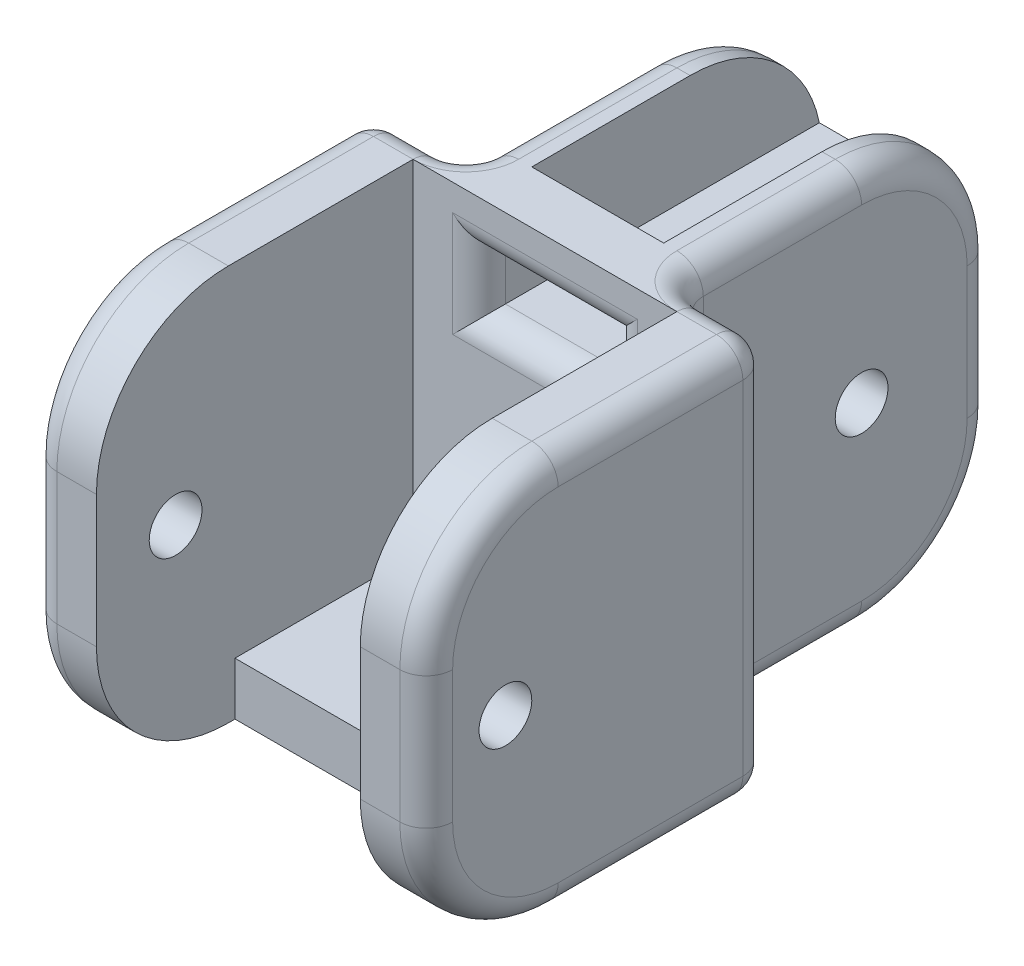
from build123d import *

# Parameters (mm, degrees)
BASE_SKETCH_W                    = 15
BASE_SKETCH_H                    = 15
BASE_SKETCH_EXTRUDE_DEPTH        = 25
CENTER_NUB_CUTOUT_SKETCH_W       = 3.5
CENTER_NUB_CUTOUT_SKETCH_H       = 15
HINGE_NUB_EXTRUDED_CUT_DEPTH     = 12
HINGE_CUTOUT_SKETCH_W            = 10
HINGE_CUTOUT_SKETCH_H            = 15
HINGE_CUTOUT_EXTRUDED_CUT_DEPTH  = 12
HINGE_HOLE_SKETCH_R              = 1
HINGE_HOLE_EXTRUDED_CUT_DEPTH    = 31.103986447
CORNER_FILLETS_R                 = 5
STYLE_FILLETS_R                  = 1
ROUTING_HOLES_SKETCH_W           = 5
ROUTING_HOLES_SKETCH_H           = 2
ROUTING_HOLES_EXTRUDED_CUT_DEPTH = 28.156951228
SKETCH1_W                        = 10
SKETCH1_H                        = 2
BACKING_EXTRUDE_DEPTH            = 6.75
EXTRA_ROUTING_CUT_SKETCH_W       = 5
EXTRA_ROUTING_CUT_SKETCH_H       = 10
EXTRA_ROUTING_EXTRUDED_CUT_DEPTH = 4
ROUTING_FILLETS_R                = 1


with BuildPart() as part:
    # Base Sketch → Base Sketch Extrude (new body)
    with BuildSketch(Plane.XY):
        Rectangle(BASE_SKETCH_W, BASE_SKETCH_H)
    extrude(amount=BASE_SKETCH_EXTRUDE_DEPTH)

    # Center Nub Cutout Sketch → Hinge Nub Extruded Cut (cut)
    with BuildSketch(Plane.XY):
        with Locations((5.75, 0)):
            Rectangle(CENTER_NUB_CUTOUT_SKETCH_W, CENTER_NUB_CUTOUT_SKETCH_H)
        with Locations((-5.75, 0)):
            Rectangle(CENTER_NUB_CUTOUT_SKETCH_W, CENTER_NUB_CUTOUT_SKETCH_H)
    extrude(amount=HINGE_NUB_EXTRUDED_CUT_DEPTH, mode=Mode.SUBTRACT)

    # Hinge Cutout Sketch → Hinge Cutout Extruded Cut (cut)
    with BuildSketch(Plane.XY.offset(25)):
        Rectangle(HINGE_CUTOUT_SKETCH_W, HINGE_CUTOUT_SKETCH_H)
    extrude(amount=-HINGE_CUTOUT_EXTRUDED_CUT_DEPTH, mode=Mode.SUBTRACT)

    # Hinge Hole Sketch → Hinge Hole Extruded Cut (cut, through all)
    with BuildSketch(Plane(origin=(7.5, 0, 0), x_dir=(0, 0, -1), z_dir=(1, 0, 0))):
        with Locations(Location((-5, 0, 0), (0, 0, 90))):
            Circle(HINGE_HOLE_SKETCH_R)
        with Locations(Location((-22, 0, 0), (0, 0, 90))):
            Circle(HINGE_HOLE_SKETCH_R)
    extrude(amount=-HINGE_HOLE_EXTRUDED_CUT_DEPTH, mode=Mode.SUBTRACT)

    # Corner Fillets
    corner_fillets_edges = [part.edges().sort_by_distance(p)[0] for p in [
        (0, -7.5, 0),
        (0, 7.5, 0),
        (-6.25, -7.5, 25),
        (-6.25, 7.5, 25),
        (6.25, -7.5, 25),
        (6.25, 7.5, 25),
    ]]
    fillet(corner_fillets_edges, radius=CORNER_FILLETS_R)

    # Style Fillets
    style_fillets_edges = [part.edges().sort_by_distance(p)[0] for p in [
        (4, 7.5, 8.5),
        (4, -7.5, 8.5),
        (7.5, 0, 12),
        (5.75, 7.5, 12),
        (4, 0, 12),
        (5.75, -7.5, 12),
        (-4, -7.5, 8.5),
        (-4, 7.5, 8.5),
        (-7.5, 0, 12),
        (-5.75, -7.5, 12),
        (-4, 0, 12),
        (-5.75, 7.5, 12),
        (-7.5, 0, 25),
        (-7.5, -7.5, 16),
        (7.5, -7.5, 16),
        (-7.5, 7.5, 16),
        (-7.5, 6.035533906, 23.535533906),
        (-7.5, -6.035533906, 23.535533906),
        (7.5, 7.5, 16),
        (7.5, 0, 25),
        (7.5, 6.035533906, 23.535533906),
        (7.5, -6.035533906, 23.535533906),
        (4, 0, 0),
        (4, 6.035533906, 1.464466094),
        (4, -6.035533906, 1.464466094),
        (-4, 0, 0),
        (-4, 6.035533906, 1.464466094),
        (-4, -6.035533906, 1.464466094),
    ]]
    fillet(style_fillets_edges, radius=STYLE_FILLETS_R)

    # Routing Holes Sketch → Routing Holes Extruded Cut (cut, through all)
    with BuildSketch(Plane.XY):
        with Locations((0, 4.5)):
            Rectangle(ROUTING_HOLES_SKETCH_W, ROUTING_HOLES_SKETCH_H)
        with Locations((0, -4.5)):
            Rectangle(ROUTING_HOLES_SKETCH_W, ROUTING_HOLES_SKETCH_H)
    extrude(amount=ROUTING_HOLES_EXTRUDED_CUT_DEPTH, mode=Mode.SUBTRACT)

    # Sketch1 → Backing Extrude (add)
    with BuildSketch(Plane.XY.offset(13)):
        with Locations((0, -6.5)):
            Rectangle(SKETCH1_W, SKETCH1_H)
    extrude(amount=BACKING_EXTRUDE_DEPTH)

    # Extra Routing Cut Sketch → Extra Routing Extruded Cut (cut)
    with BuildSketch(Plane(origin=(0, 7.5, 0), x_dir=(1, 0, 0), z_dir=(0, 1, 0))):
        with Locations((0, -6)):
            Rectangle(EXTRA_ROUTING_CUT_SKETCH_W, EXTRA_ROUTING_CUT_SKETCH_H)
    extrude(amount=-EXTRA_ROUTING_EXTRUDED_CUT_DEPTH, mode=Mode.SUBTRACT)

    # Routing Fillets
    routing_fillets_edges = [part.edges().sort_by_distance(p)[0] for p in [
        (0, -3.5, 0.101020514),
        (2.5, -4.5, 13),
        (0, -3.5, 13),
        (-2.5, -4.5, 13),
        (2.5, 4.5, 13),
        (0, 3.5, 13),
        (-2.5, 4.5, 13),
        (0, 5.5, 13),
        (0, 5.5, 11),
    ]]
    fillet(routing_fillets_edges, radius=ROUTING_FILLETS_R - 0.0001)  # a hair under: the kernel refuses the full size


solid = part.part
